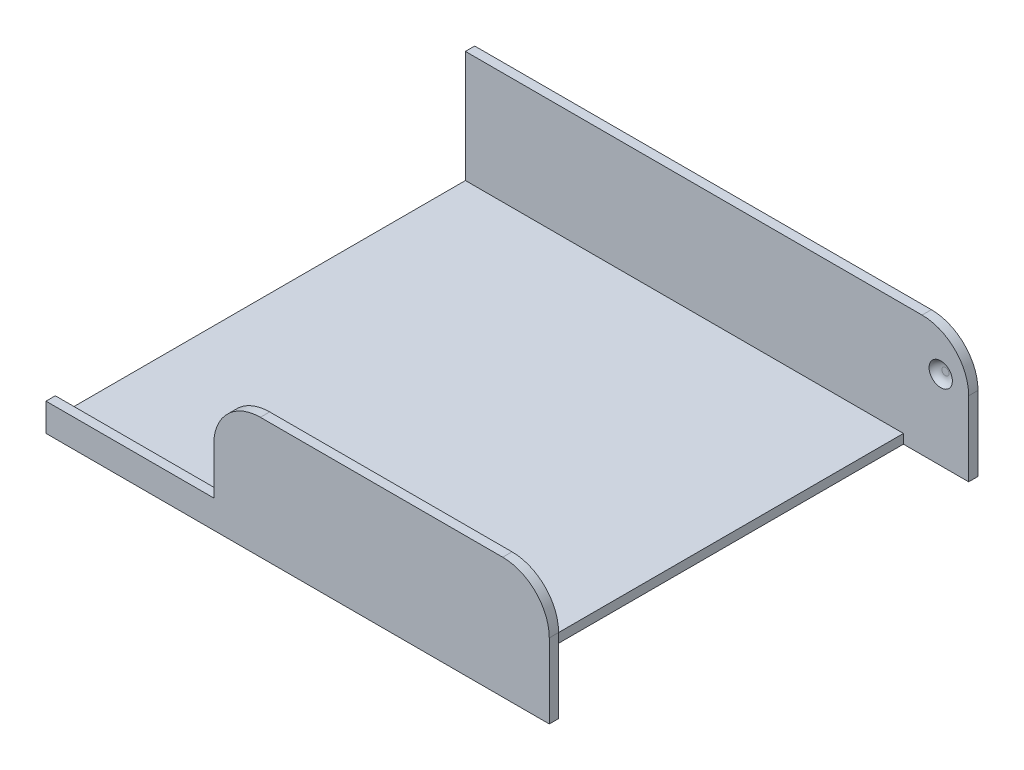
from build123d import *

# Parameters (mm, degrees)
SKETCH1_W           = 108
SKETCH1_H           = 88
BOSS_EXTRUDE2_DEPTH = 2
SKETCH1_3_W         = 112
SKETCH1_3_H         = 92
SKETCH1_3_W_2       = 108
SKETCH1_3_H_2       = 88
BOSS_EXTRUDE3_DEPTH = 26
SKETCH5_W           = 92
SKETCH5_H           = 26
CUT_EXTRUDE1_DEPTH  = 2
SKETCH6_R           = 2.75
CUT_EXTRUDE2_DEPTH  = 1
SKETCH7_R           = 2.5
CUT_EXTRUDE3_DEPTH  = 1
FILLET1_R           = 2
FILLET2_R           = 2
SKETCH9_W           = 38
SKETCH9_H           = 20
CUT_EXTRUDE4_DEPTH  = 2
SKETCH10_W          = 92
SKETCH10_H          = 26
CUT_EXTRUDE5_DEPTH  = 2
FILLET3_R           = 10
FILLET4_R           = 10
FILLET5_R           = 10
SKETCH11_W          = 14
SKETCH11_H          = 88
CUT_EXTRUDE6_DEPTH  = 2


with BuildPart() as part:
    # Sketch1 → Boss-Extrude2 (new body)
    with BuildSketch(Plane(origin=(0, 0, 0), x_dir=(1, 0, 0), z_dir=(0, 1, 0))):
        with Locations((54, 44)):
            Rectangle(SKETCH1_W, SKETCH1_H)
    extrude(amount=BOSS_EXTRUDE2_DEPTH)

    # Sketch1<3> → Boss-Extrude3 (add)
    with BuildSketch(Plane(origin=(0, 0, 0), x_dir=(1, 0, 0), z_dir=(0, 1, 0))):
        with Locations((54, 44)):
            Rectangle(SKETCH1_3_W, SKETCH1_3_H)
        with Locations((54, 44)):
            Rectangle(SKETCH1_3_W_2, SKETCH1_3_H_2, mode=Mode.SUBTRACT)
    extrude(amount=BOSS_EXTRUDE3_DEPTH)

    # Sketch5 → Cut-Extrude1 (cut)
    with BuildSketch(Plane(origin=(110, 0, 0), x_dir=(0, 0, -1), z_dir=(1, 0, 0))):
        with Locations((44, 13)):
            Rectangle(SKETCH5_W, SKETCH5_H)
    extrude(amount=-CUT_EXTRUDE1_DEPTH, mode=Mode.SUBTRACT)

    # Sketch6 → Cut-Extrude2 (cut)
    with BuildSketch(Plane(origin=(0, 0, 0), x_dir=(-1, 0, 0), z_dir=(0, 0, -1))):
        with Locations((-102, 17)):
            Circle(SKETCH6_R)
    extrude(amount=-CUT_EXTRUDE2_DEPTH, mode=Mode.SUBTRACT)

    # Sketch7 → Cut-Extrude3 (cut)
    with BuildSketch(Plane.XY.offset(-88)):
        with Locations((102, 17)):
            Circle(SKETCH7_R)
    extrude(amount=-CUT_EXTRUDE3_DEPTH, mode=Mode.SUBTRACT)

    # Fillet1
    # the kernel refuses this fillet: 2 mm, written as the material it adds along each edge
    with BuildSketch(Plane(origin=(102, 17, 1), x_dir=(-1, 0, 0), z_dir=(0, -1, 0))) as fillet1_piece_1:
        with BuildLine():
            CenterArc((1.017949192, 2), FILLET1_R, 270, 60)
            Line((1.017949192, 0), (1.017949192, -0.04))
            Line((1.017949192, -0.04), (2.75, -0.04))
            Line((2.75, -0.04), (2.79, 0))
            ThreePointArc((2.79, 0), (2.79, 0.5), (2.784641016, 0.98))
            Line((2.784641016, 0.98), (2.75, 1))
        make_face()
    revolve(axis=Axis((102, 17, 1), (0, 0, -1)))

    # Fillet2
    # the kernel refuses this fillet: 2 mm, written as the material it adds along each edge
    with BuildSketch(Plane(origin=(102, 17, -89), x_dir=(1, 0, 0), z_dir=(0, -1, 0))) as fillet2_piece_1:
        with BuildLine():
            CenterArc((0.767949192, 2), FILLET2_R, 270, 60)
            Line((0.767949192, 0), (0.767949192, -0.04))
            Line((0.767949192, -0.04), (2.5, -0.04))
            Line((2.5, -0.04), (2.54, 0))
            ThreePointArc((2.54, 0), (2.54, 0.5), (2.534641016, 0.98))
            Line((2.534641016, 0.98), (2.5, 1))
        make_face()
    revolve(axis=Axis((102, 17, -89), (0, 0, 1)))

    # Sketch9 → Cut-Extrude4 (cut)
    with BuildSketch(Plane.XY.offset(2)):
        with Locations((17, 16)):
            Rectangle(SKETCH9_W, SKETCH9_H)
    extrude(amount=-CUT_EXTRUDE4_DEPTH, mode=Mode.SUBTRACT)

    # Sketch10 → Cut-Extrude5 (cut)
    with BuildSketch(Plane.ZY.offset(2)):
        with Locations((-44, 13)):
            Rectangle(SKETCH10_W, SKETCH10_H)
    extrude(amount=-CUT_EXTRUDE5_DEPTH, mode=Mode.SUBTRACT)

    # Fillet3
    fillet3_edges = [part.edges().sort_by_distance(p)[0] for p in [
        (36, 26, 1),
    ]]
    fillet(fillet3_edges, radius=FILLET3_R)

    # Fillet4
    fillet4_edges = [part.edges().sort_by_distance(p)[0] for p in [
        (108, 26, 1),
    ]]
    fillet(fillet4_edges, radius=FILLET4_R)

    # Fillet5
    fillet5_edges = [part.edges().sort_by_distance(p)[0] for p in [
        (108, 26, -89),
    ]]
    fillet(fillet5_edges, radius=FILLET5_R)

    # Sketch11 → Cut-Extrude6 (cut)
    with BuildSketch(Plane(origin=(0, 0, 0), x_dir=(-1, 0, 0), z_dir=(0, -1, 0))):
        with Locations((-101, 44)):
            Rectangle(SKETCH11_W, SKETCH11_H)
    extrude(amount=-CUT_EXTRUDE6_DEPTH, mode=Mode.SUBTRACT)


solid = part.part
